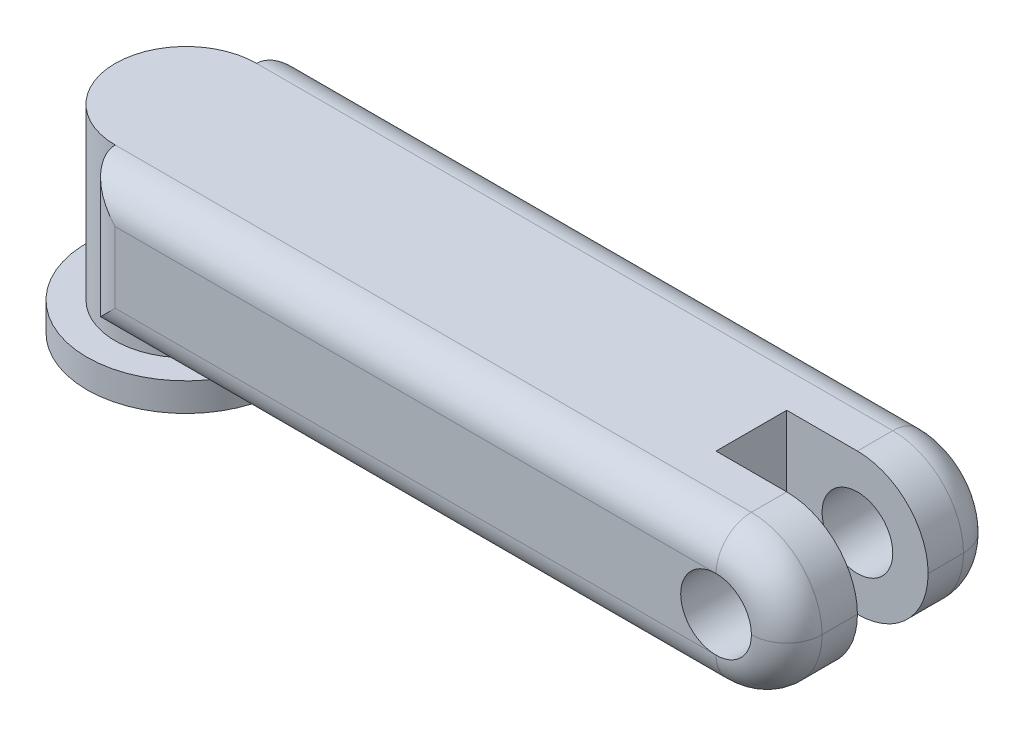
from build123d import *

# Parameters (mm, degrees)
BOSS_EXTRUDE1_DEPTH = 10
SKETCH2_R           = 2.5
CUT_EXTRUDE1_DEPTH  = 52.23475383
SKETCH3_R           = 5
BOSS_EXTRUDE2_DEPTH = 12
SKETCH4_R           = 7
BOSS_EXTRUDE3_DEPTH = 2
FILLET1_R           = 5
FILLET2_R           = 2.5


with BuildPart() as part:
    # Sketch1 → Boss-Extrude1 (new body)
    with BuildSketch(Plane(origin=(0, 0, 0), x_dir=(1, 0, 0), z_dir=(0, 1, 0))):
        Polygon((40, 0), (40, -2.5), (50, -2.5), (50, -7.5), (0, -7.5), (0, 0), align=None)
    boss_extrude1 = extrude(amount=BOSS_EXTRUDE1_DEPTH)

    # Sketch2 → Cut-Extrude1 (cut, through all)
    with BuildSketch(Plane(origin=(0, 0, 2.5), x_dir=(-1, 0, 0), z_dir=(0, 0, -1))):
        with Locations((-45, 5)):
            Circle(SKETCH2_R)
    cut_extrude1 = extrude(amount=-CUT_EXTRUDE1_DEPTH, mode=Mode.SUBTRACT)

    # Mirror1: Boss-Extrude1, Cut-Extrude1 across plane
    add(boss_extrude1.mirror(Plane(origin=(0, 10, 0), x_dir=(1, 0, 0), z_dir=(0, 0, 1))))
    add(cut_extrude1.mirror(Plane(origin=(0, 10, 0), x_dir=(1, 0, 0), z_dir=(0, 0, 1))), mode=Mode.SUBTRACT)

    # Sketch3 → Boss-Extrude2 (add)
    with BuildSketch(Plane(origin=(0, 10, 0), x_dir=(1, 0, 0), z_dir=(0, 1, 0))):
        with Locations(Location((0, 0, 0), (0, 0, 270))):
            Circle(SKETCH3_R)
    extrude(amount=-BOSS_EXTRUDE2_DEPTH)

    # Sketch4 → Boss-Extrude3 (add)
    with BuildSketch(Plane.XZ.offset(2)):
        with Locations(Location((0, 0, 0), (0, 0, 270))):
            Circle(SKETCH4_R)
    extrude(amount=BOSS_EXTRUDE3_DEPTH)

    # Fillet1
    fillet1_edges = [part.edges().sort_by_distance(p)[0] for p in [
        (50, 0, -5),
        (50, 10, -5),
        (50, 0, 5),
        (50, 10, 5),
    ]]
    fillet(fillet1_edges, radius=FILLET1_R - 0.0001)  # a hair under: the kernel refuses the full size

    # Fillet2
    fillet2_edges = [part.edges().sort_by_distance(p)[0] for p in [
        (22.50005, 10, -7.5),
        (48.535563195, 8.535563195, -7.5),
        (48.535563195, 1.464436805, -7.5),
        (22.50005, 10, 7.5),
        (48.535563195, 8.535563195, 7.5),
        (48.535563195, 1.464436805, 7.5),
        (22.50005, 0, -7.5),
        (0, 5, -7.5),
        (0, 5, 7.5),
        (22.50005, 0, 7.5),
    ]]
    fillet(fillet2_edges, radius=FILLET2_R - 0.0001)  # a hair under: the kernel refuses the full size


solid = part.part
